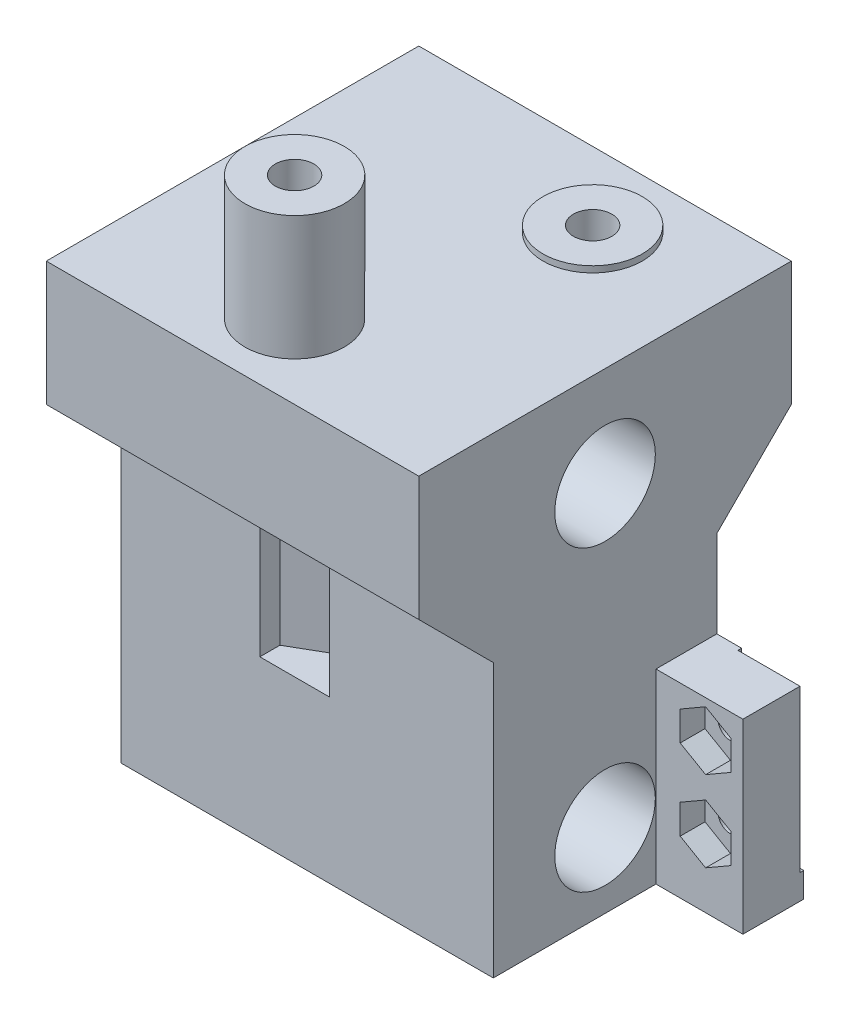
from build123d import *

# Parameters (mm, degrees)
SKETCH_1_W          = 30
SKETCH_1_H          = 30
EXTRUDE_1_DEPTH     = 38
SKETCH_3_R          = 4
EXTRUDE_3_DEPTH     = 0.5
SKETCH_7_R          = 4
EXTRUDE_4_DEPTH     = 10
SKETCH_6_R          = 4.05
CUT_EXTRUDE_3_DEPTH = 65.062469512
SKETCH_9_R          = 1.55
CUT_EXTRUDE_4_DEPTH = 51.833060109
CUT_EXTRUDE_6_DEPTH = 65.062469512
CUT_EXTRUDE_5_DEPTH = 15
SKETCH_12_W         = 4.9
SKETCH_12_H         = 15
EXTRUDE_5_DEPTH     = 7
SKETCH_13_W         = 5
SKETCH_13_H         = 13
CUT_EXTRUDE_7_DEPTH = 0.3
SKETCH_14_R         = 1
CUT_EXTRUDE_8_DEPTH = 66.074495772
CUT_EXTRUDE_9_DEPTH = 2


with BuildPart() as part:
    # 草图1 → 凸台-拉伸1 (new body)
    with BuildSketch(Plane(origin=(0, 0, 0), x_dir=(1, 0, 0), z_dir=(0, 1, 0))):
        with Locations((15, 15)):
            Rectangle(SKETCH_1_W, SKETCH_1_H)
    extrude(amount=EXTRUDE_1_DEPTH)

    # 草图3 → 凸台-拉伸3 (add)
    with BuildSketch(Plane(origin=(0, 38, -50), x_dir=(1, 0, 0), z_dir=(0, -1, 0))):
        with Locations((20, 26)):
            Circle(SKETCH_3_R)
    extrude(amount=-EXTRUDE_3_DEPTH)

    # 草图7 → 凸台-拉伸4 (add)
    with BuildSketch(Plane.XZ.offset(-38)):
        with Locations((14, -6)):
            Circle(SKETCH_7_R)
    extrude(amount=-EXTRUDE_4_DEPTH)

    # 草图6 → 切除-拉伸3 (cut, through all)
    with BuildSketch(Plane(origin=(30, 0, 0), x_dir=(0, 0, -1), z_dir=(1, 0, 0))):
        with Locations((15, 6)):
            Circle(SKETCH_6_R)
        with Locations((15, 30)):
            Circle(SKETCH_6_R)
    extrude(amount=-CUT_EXTRUDE_3_DEPTH, mode=Mode.SUBTRACT)

    # 草图9 → 切除-拉伸4 (cut, through all)
    with BuildSketch(Plane(origin=(0, 28, 0), x_dir=(1, 0, 0), z_dir=(0, 1, 0))):
        with Locations((14, 6)):
            Circle(SKETCH_9_R)
        with Locations((20, 24)):
            Circle(SKETCH_9_R)
    extrude(amount=CUT_EXTRUDE_4_DEPTH, mode=Mode.SUBTRACT)

    # 草图11 → 切除-拉伸6 (cut, through all)
    with BuildSketch(Plane(origin=(30, 0, 0), x_dir=(0, 0, -1), z_dir=(1, 0, 0))):
        Polygon((6, 0), (6, 22), (0, 28), (0, 0), align=None)
        Polygon((24, 0), (24, 22), (30, 28), (30, 0), align=None)
    extrude(amount=-CUT_EXTRUDE_6_DEPTH, mode=Mode.SUBTRACT)

    # 草图10 → 切除-拉伸5 (cut)
    with BuildSketch(Plane(origin=(0, 28, 0), x_dir=(1, 0, 0), z_dir=(0, 1, 0))):
        Polygon((16.8, 0), (16.8, 7.616580754), (14, 9.233161507), (11.2, 7.616580754), (11.2, 0), align=None)
        Polygon((20, 20.766838493), (22.8, 22.383419246), (22.8, 30), (17.2, 30), (17.2, 22.383419246), align=None)
    extrude(amount=-CUT_EXTRUDE_5_DEPTH, mode=Mode.SUBTRACT)

    # 草图12 → 凸台-拉伸5 (add)
    with BuildSketch(Plane(origin=(30, 0, 0), x_dir=(0, 0, -1), z_dir=(1, 0, 0))):
        with Locations((21.55, 7.5)):
            Rectangle(SKETCH_12_W, SKETCH_12_H)
    extrude(amount=EXTRUDE_5_DEPTH)

    # 草图13 → 切除-拉伸7 (cut)
    with BuildSketch(Plane(origin=(0, 0, -24), x_dir=(-1, 0, 0), z_dir=(0, 0, -1))):
        with Locations((-34.5, 8.5)):
            Rectangle(SKETCH_13_W, SKETCH_13_H)
    extrude(amount=-CUT_EXTRUDE_7_DEPTH, mode=Mode.SUBTRACT)

    # 草图14 → 切除-拉伸8 (cut, through all)
    with BuildSketch(Plane(origin=(0, 0, -23.7), x_dir=(-1, 0, 0), z_dir=(0, 0, -1))):
        with Locations((-34, 12)):
            Circle(SKETCH_14_R)
        with Locations((-34, 5.5)):
            Circle(SKETCH_14_R)
    extrude(amount=-CUT_EXTRUDE_8_DEPTH, mode=Mode.SUBTRACT)

    # 草图15 → 切除-拉伸9 (cut)
    with BuildSketch(Plane.XY.offset(-19.1)):
        Polygon((36.05, 10.816431948), (36.05, 13.183568052), (34, 14.367136104), (31.95, 13.183568052), (31.95, 10.816431948), (34, 9.632863896), align=None)
        Polygon((34, 3.132863896), (36.05, 4.316431948), (36.05, 6.683568052), (34, 7.867136104), (31.95, 6.683568052), (31.95, 4.316431948), align=None)
    extrude(amount=-CUT_EXTRUDE_9_DEPTH, mode=Mode.SUBTRACT)


solid = part.part
